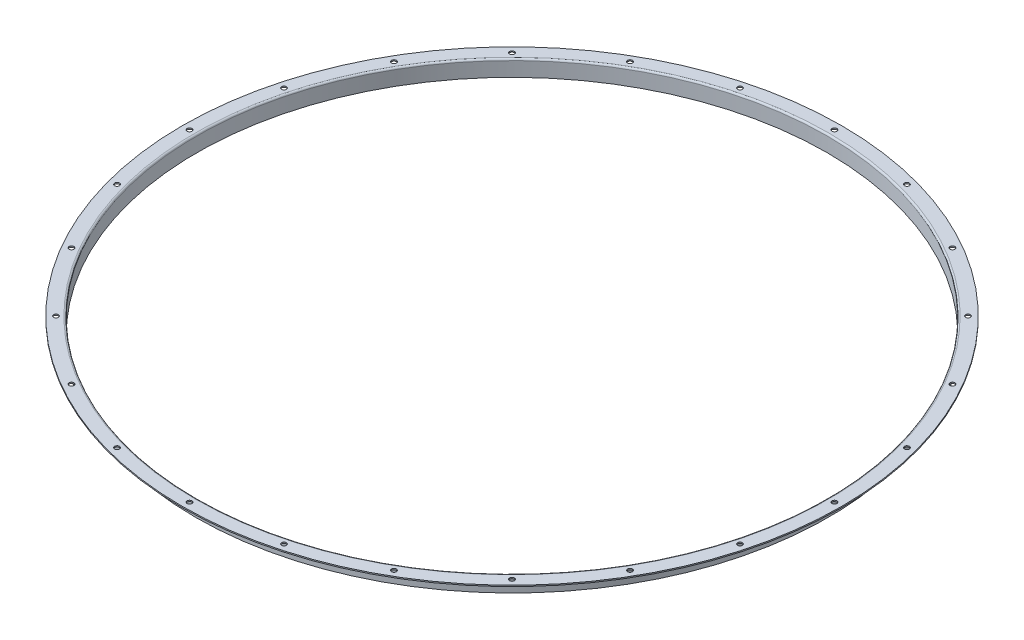
from build123d import *

# Parameters (mm, degrees)
SKETCH1_R          = 682.5
SKETCH1_R_2        = 652.5
BASE_FLANGE1_DEPTH = 2.5
SKETCH8_R          = 5
CUT_EXTRUDE1_DEPTH = 10


# Read off the part's stored shape, not the designer's step: Edge-Flange1
# Sheet-metal steps are written as plain solids
with BuildPart() as part:
    # Sketch1 → Base-Flange1 (new body)
    with BuildSketch(Plane(origin=(0, 0, 0), x_dir=(1, 0, 0), z_dir=(0, 1, 0))):
        with Locations(Location((0, 0, 0), (0, 0, 270))):
            Circle(SKETCH1_R)
        with Locations(Location((0, 0, 0), (0, 0, 270))):
            Circle(SKETCH1_R_2, mode=Mode.SUBTRACT)
    extrude(amount=-BASE_FLANGE1_DEPTH)

    # Edge-Flange1 outline → Edge-Flange1 (revolve, cut)
    with BuildSketch(Plane.XY):
        with BuildLine():
            Line((652.5, -2.5), (652.645898034, -2.5))
            ThreePointArc((652.645898034, -2.5), (653.908349934, -0.69375696), (656, 0))
            Line((656, 0), (652.5, 0))
            Line((652.5, 0), (652.5, -2.5))
        make_face()
    revolve(axis=Axis((0, 0, 0), (0, 1, 0)), mode=Mode.SUBTRACT)

    # Edge-Flange1 2 outline → Edge-Flange1 2 (revolve)
    with BuildSketch(Plane.XY):
        with BuildLine():
            Line((652.5, -3.5), (652.5, -33.5))
            Line((652.5, -33.5), (655, -33.5))
            Line((655, -33.5), (655, -3.5))
            ThreePointArc((655, -3.5), (655.292893219, -2.792893219), (656, -2.5))
            Line((656, -2.5), (652.645898034, -2.5))
            ThreePointArc((652.645898034, -2.5), (652.536666571, -2.994706462), (652.5, -3.5))
        make_face()
    revolve(axis=Axis((0, 0, 0), (0, 1, 0)))

    # Sketch8 → Cut-Extrude1 (cut)
    with BuildSketch(Plane(origin=(0, 0, 0), x_dir=(1, 0, 0), z_dir=(0, 1, 0))):
        with Locations(Location((172.761712606, 644.755489048, 0), (0, 0, 270))):
            Circle(SKETCH8_R)
        with Locations(Location((333.75, 578.071957026, 0), (0, 0, 270))):
            Circle(SKETCH8_R)
        with Locations(Location((0, 667.5, 0), (0, 0, 270))):
            Circle(SKETCH8_R)
        with Locations(Location((471.993776442, 471.993776442, 0), (0, 0, 270))):
            Circle(SKETCH8_R)
        with Locations(Location((578.071957026, 333.75, 0), (0, 0, 270))):
            Circle(SKETCH8_R)
        with Locations(Location((644.755489048, 172.761712606, 0), (0, 0, 270))):
            Circle(SKETCH8_R)
        with Locations(Location((667.5, 0, 0), (0, 0, 270))):
            Circle(SKETCH8_R)
        with Locations(Location((644.755489048, -172.761712606, 0), (0, 0, 270))):
            Circle(SKETCH8_R)
        with Locations(Location((578.071957026, -333.75, 0), (0, 0, 270))):
            Circle(SKETCH8_R)
        with Locations(Location((471.993776442, -471.993776442, 0), (0, 0, 270))):
            Circle(SKETCH8_R)
        with Locations(Location((333.75, -578.071957026, 0), (0, 0, 270))):
            Circle(SKETCH8_R)
        with Locations(Location((172.761712606, -644.755489048, 0), (0, 0, 270))):
            Circle(SKETCH8_R)
        with Locations(Location((0, -667.5, 0), (0, 0, 270))):
            Circle(SKETCH8_R)
        with Locations(Location((-172.761712606, -644.755489048, 0), (0, 0, 270))):
            Circle(SKETCH8_R)
        with Locations(Location((-333.75, -578.071957026, 0), (0, 0, 270))):
            Circle(SKETCH8_R)
        with Locations(Location((-471.993776442, -471.993776442, 0), (0, 0, 270))):
            Circle(SKETCH8_R)
        with Locations(Location((-578.071957026, -333.75, 0), (0, 0, 270))):
            Circle(SKETCH8_R)
        with Locations(Location((-644.755489048, -172.761712606, 0), (0, 0, 270))):
            Circle(SKETCH8_R)
        with Locations(Location((-667.5, 0, 0), (0, 0, 270))):
            Circle(SKETCH8_R)
        with Locations(Location((-644.755489048, 172.761712606, 0), (0, 0, 270))):
            Circle(SKETCH8_R)
        with Locations(Location((-578.071957026, 333.75, 0), (0, 0, 270))):
            Circle(SKETCH8_R)
        with Locations(Location((-471.993776442, 471.993776442, 0), (0, 0, 270))):
            Circle(SKETCH8_R)
        with Locations(Location((-333.75, 578.071957026, 0), (0, 0, 270))):
            Circle(SKETCH8_R)
        with Locations(Location((-172.761712606, 644.755489048, 0), (0, 0, 270))):
            Circle(SKETCH8_R)
    extrude(amount=-CUT_EXTRUDE1_DEPTH, mode=Mode.SUBTRACT)


solid = part.part
